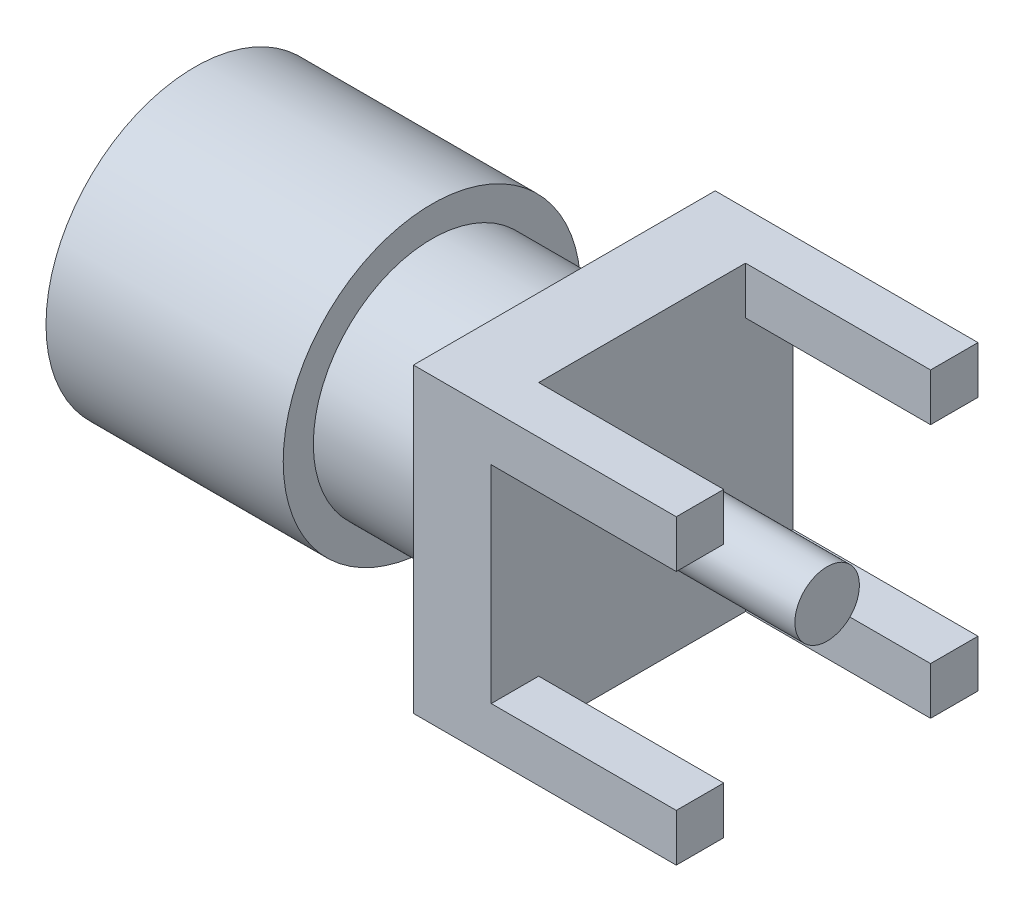
from build123d import *

# Parameters (mm, degrees)
BOSS_EXTRUDE1_DEPTH      = 3.18
BOSS_EXTRUDE1_DEPTH_BACK = 3.18
SKETCH1_W                = 1.64
SKETCH1_H                = 6.36
SKETCH2_R                = 2.5
BOSS_EXTRUDE2_DEPTH      = 2.79
SKETCH3_R                = 3.135
BOSS_EXTRUDE3_DEPTH      = 5
SKETCH4_W                = 1
SKETCH4_H                = 1
BOSS_EXTRUDE4_DEPTH      = 3.9
SKETCH5_R                = 0.68
BOSS_EXTRUDE5_DEPTH      = 3.9
SKETCH6_R                = 2.245
CUT_EXTRUDE1_DEPTH       = 2


with BuildPart() as part:
    # Sketch1 → Boss-Extrude1 (new, two sides: drawn at the far end of the back side and taken through both)
    with BuildSketch(Plane.XY.offset(-BOSS_EXTRUDE1_DEPTH_BACK)):
        Rectangle(SKETCH1_W, SKETCH1_H)
    extrude(amount=BOSS_EXTRUDE1_DEPTH + BOSS_EXTRUDE1_DEPTH_BACK)

    # Sketch2 → Boss-Extrude2 (add)
    with BuildSketch(Plane.ZY.offset(0.82)):
        Circle(SKETCH2_R)
    extrude(amount=BOSS_EXTRUDE2_DEPTH)

    # Sketch3 → Boss-Extrude3 (add)
    with BuildSketch(Plane.ZY.offset(3.61)):
        Circle(SKETCH3_R)
    extrude(amount=BOSS_EXTRUDE3_DEPTH)

    # Sketch4 → Boss-Extrude4 (add)
    with BuildSketch(Plane(origin=(0.82, 0, 0), x_dir=(0, 0, -1), z_dir=(1, 0, 0))):
        with Locations((-2.68, 2.68)):
            Rectangle(SKETCH4_W, SKETCH4_H)
        with Locations((2.68, 2.68)):
            Rectangle(SKETCH4_W, SKETCH4_H)
        with Locations((-2.68, -2.68)):
            Rectangle(SKETCH4_W, SKETCH4_H)
        with Locations((2.68, -2.68)):
            Rectangle(SKETCH4_W, SKETCH4_H)
    extrude(amount=BOSS_EXTRUDE4_DEPTH)

    # Sketch5 → Boss-Extrude5 (add)
    with BuildSketch(Plane(origin=(0.82, 0, 0), x_dir=(0, 0, -1), z_dir=(1, 0, 0))):
        Circle(SKETCH5_R)
    extrude(amount=BOSS_EXTRUDE5_DEPTH)

    # Sketch6 → Cut-Extrude1 (cut)
    with BuildSketch(Plane.ZY.offset(8.61)):
        Circle(SKETCH6_R)
    extrude(amount=-CUT_EXTRUDE1_DEPTH, mode=Mode.SUBTRACT)


solid = part.part
